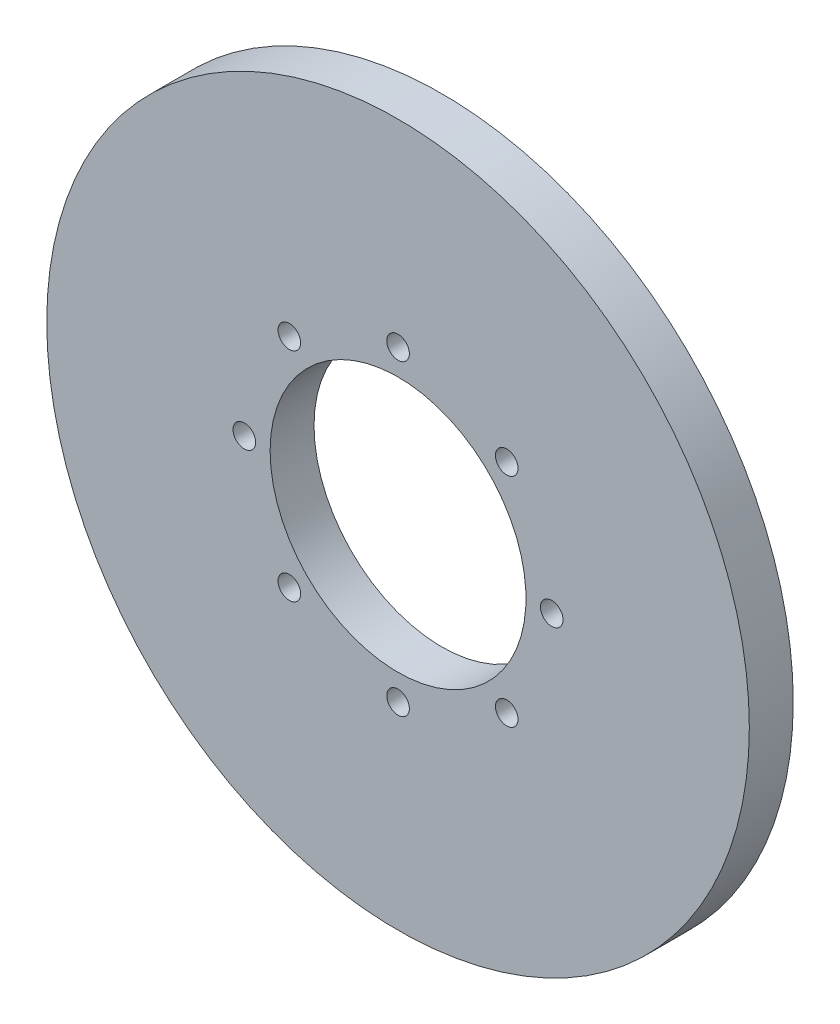
from build123d import *

# Parameters (mm, degrees)
SKETCH1_R                  = 152.4
BOSS_EXTRUDE1_DEPTH        = 19.05
SKETCH5_R                  = 55
CUT_EXTRUDE1_DEPTH         = 217.366407975
F_3_8_CLEARANCE_HOLE1_D    = 9.8044
NIPPLE_SOCKET_CLEARANCE_BY = 0.5


with BuildPart() as part:
    # Sketch1 → Boss-Extrude1 (new body)
    with BuildSketch(Plane.XY):
        Circle(SKETCH1_R)
    extrude(amount=BOSS_EXTRUDE1_DEPTH)

    # Sketch5 → Cut-Extrude1 (cut, through all)
    with BuildSketch(Plane(origin=(0, 0, 0), x_dir=(-1, 0, 0), z_dir=(0, 0, -1))):
        Circle(SKETCH5_R)
    extrude(amount=-CUT_EXTRUDE1_DEPTH, mode=Mode.SUBTRACT)

    # 3/8 Clearance Hole1 (through all)
    with Locations(Plane.XY.offset(19.05)):
        with Locations((0, -66.675), (47.146344636, -47.146344636), (66.675, 0), (47.146344636, 47.146344636), (0, 66.675), (-47.146344636, 47.146344636), (-66.675, 0), (-47.146344636, -47.146344636)):
            Hole(F_3_8_CLEARANCE_HOLE1_D / 2)

    # nipple-socket-clearance: a curved face moved inward by 0.5
    add(Solid.thicken(part.faces().sort_by_distance((55, 0, 9.525))[0], -NIPPLE_SOCKET_CLEARANCE_BY), mode=Mode.SUBTRACT)


solid = part.part
